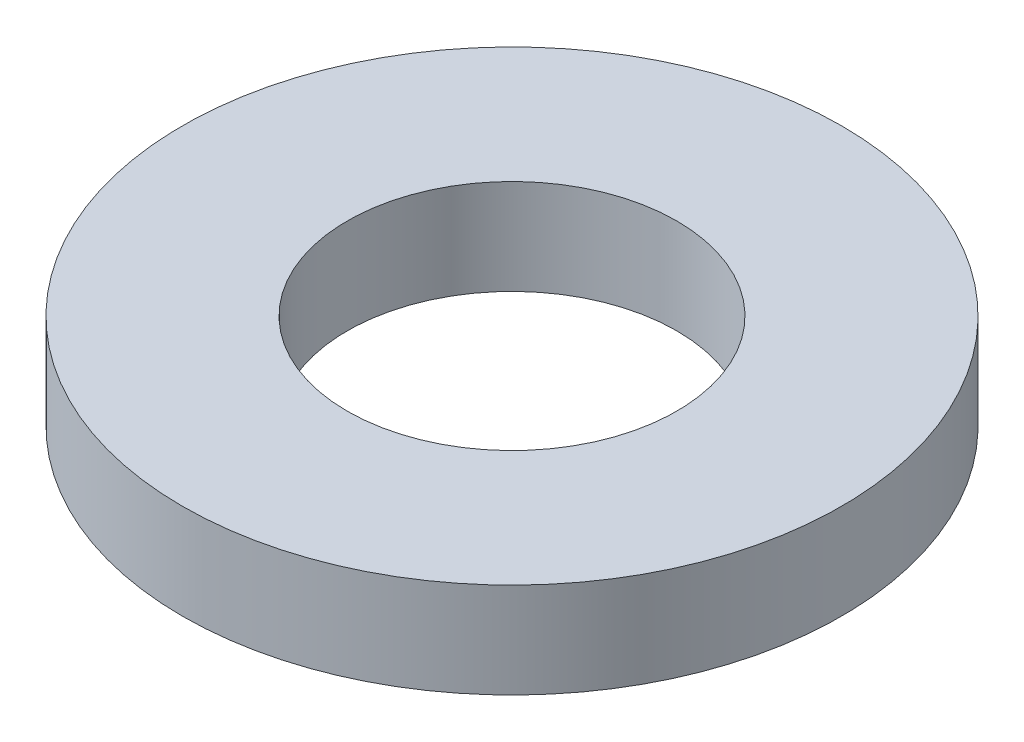
from build123d import *

# Parameters (mm, degrees)
SKETCH1_R           = 90
BOSS_EXTRUDE1_DEPTH = 26
SKETCH2_R           = 45
CUT_EXTRUDE1_DEPTH  = 130.907659512


with BuildPart() as part:
    # Sketch1 → Boss-Extrude1 (new body)
    with BuildSketch(Plane(origin=(0, 0, 0), x_dir=(1, 0, 0), z_dir=(0, 1, 0))):
        Circle(SKETCH1_R)
    extrude(amount=BOSS_EXTRUDE1_DEPTH)

    # Sketch2 → Cut-Extrude1 (cut, through all)
    with BuildSketch(Plane(origin=(0, 0, 0), x_dir=(1, 0, 0), z_dir=(0, 1, 0))):
        Circle(SKETCH2_R)
    extrude(amount=CUT_EXTRUDE1_DEPTH, mode=Mode.SUBTRACT)


solid = part.part
